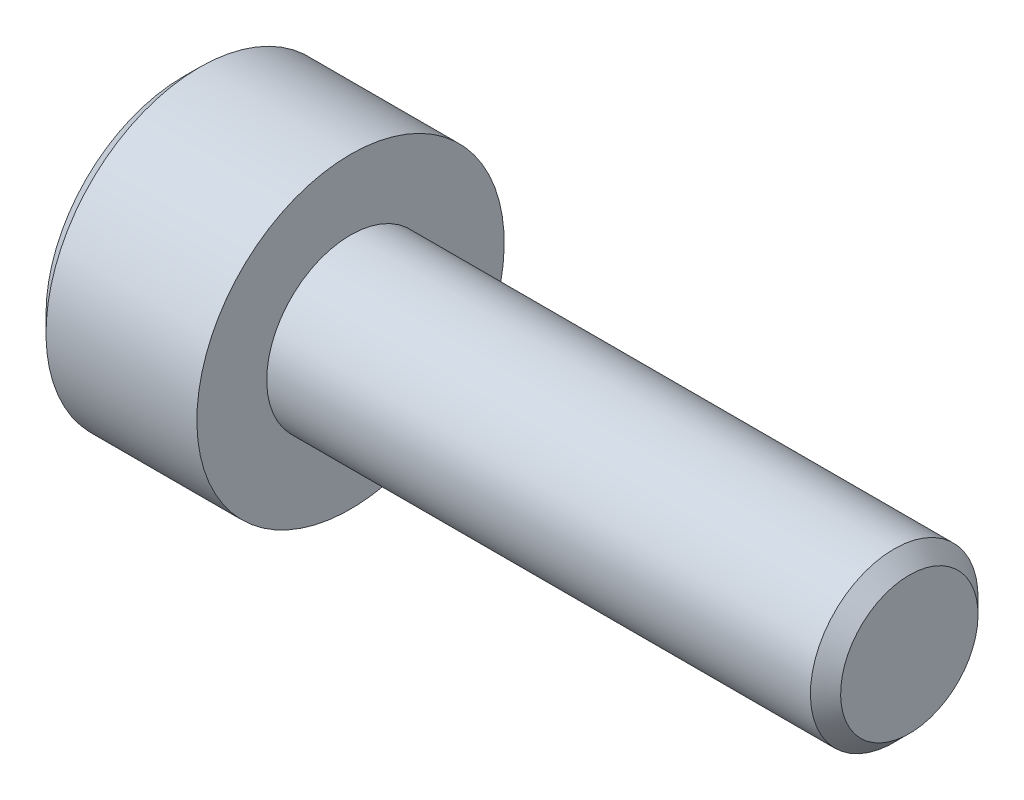
from build123d import *

# Parameters (mm, degrees)
CUT_EXTRUDE1_DEPTH = 1.5


with BuildPart() as part:
    # Sketch1 → Revolve1 (revolve)
    with BuildSketch(Plane.XY):
        Polygon((0, 1.5), (0, 2.75), (-2.7, 2.75), (-3, 2.45), (-3, 0), (10, 0), (10, 1.2295), (9.7295, 1.5), align=None)
    revolve(axis=Axis((10, 0, 0), (-1, 0, 0)))

    # Sketch2 → Cut-Extrude1 (cut)
    with BuildSketch(Plane.ZY.offset(3)):
        Polygon((0, 1.443375673), (-1.25, 0.721687836), (-1.25, -0.721687836), (0, -1.443375673), (1.25, -0.721687836), (1.25, 0.721687836), align=None)
    extrude(amount=-CUT_EXTRUDE1_DEPTH, mode=Mode.SUBTRACT)


solid = part.part
